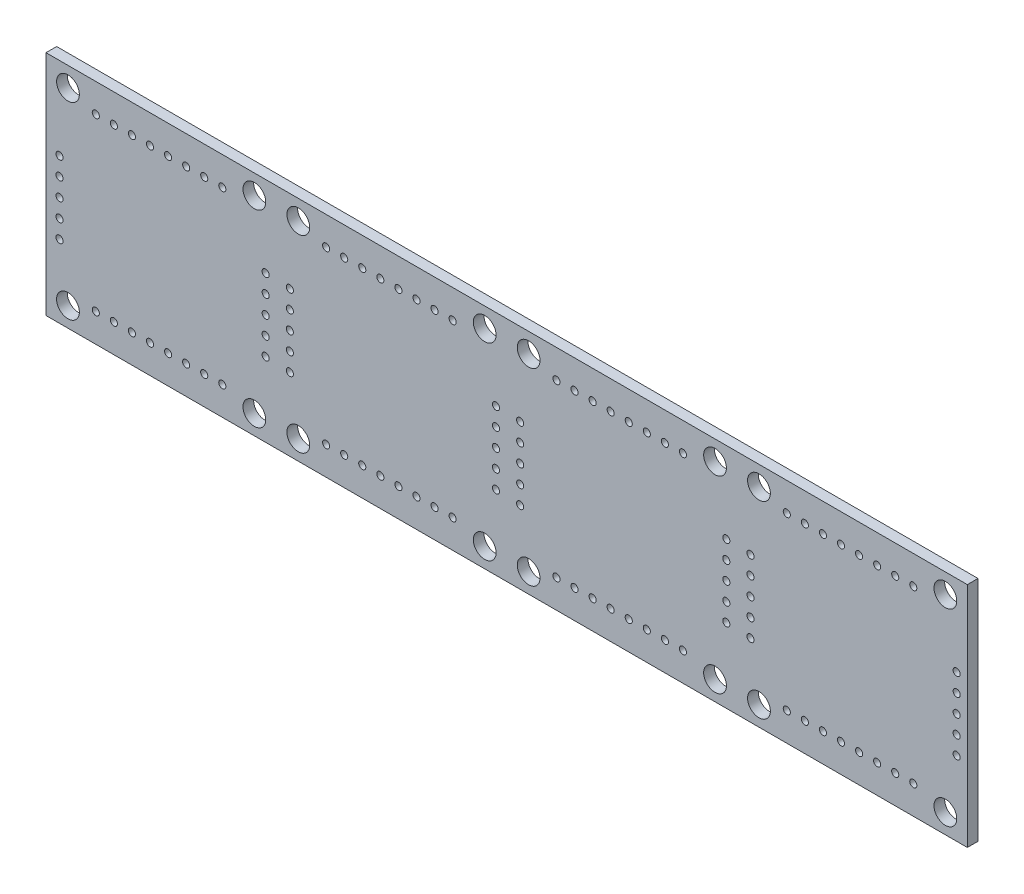
from build123d import *

# Parameters (mm, degrees)
SKETCH1_W                        = 32.375
SKETCH1_H                        = 32
SKETCH1_R                        = 1.6
BOSS_EXTRUDE1_DEPTH              = 1.5
SKETCH3_R                        = 0.5
CUT_EXTRUDE1_DEPTH               = 1.5
R_P_TITION_LIN_AIRE1_OUTLINE_W   = 97.125
R_P_TITION_LIN_AIRE1_OUTLINE_H   = 32
R_P_TITION_LIN_AIRE1_OUTLINE_R   = 1.6
R_P_TITION_LIN_AIRE1_OUTLINE_R_2 = 0.5
R_P_TITION_LIN_AIRE1_DEPTH       = 1.5


# Read off the part's stored shape, not the designer's step: Répétition linéaire1
with BuildPart() as part:
    # Sketch1 → Boss-Extrude1 (new body)
    with BuildSketch(Plane.XY):
        Rectangle(SKETCH1_W, SKETCH1_H)
        with Locations((-13.1, -13.25)):
            Circle(SKETCH1_R, mode=Mode.SUBTRACT)
        with Locations((13.1, -13.25)):
            Circle(SKETCH1_R, mode=Mode.SUBTRACT)
        with Locations((13.1, 13.25)):
            Circle(SKETCH1_R, mode=Mode.SUBTRACT)
        with Locations((-13.1, 13.25)):
            Circle(SKETCH1_R, mode=Mode.SUBTRACT)
    extrude(amount=BOSS_EXTRUDE1_DEPTH)

    # Sketch3 → Cut-Extrude1 (cut)
    with BuildSketch(Plane(origin=(0, 0, 0), x_dir=(-1, 0, 0), z_dir=(0, 0, -1))):
        with Locations((-14.6875, 4.6)):
            Circle(SKETCH3_R)
        with Locations((-14.6875, 2.06)):
            Circle(SKETCH3_R)
        with Locations((-14.6875, -0.48)):
            Circle(SKETCH3_R)
        with Locations((-14.6875, -3.02)):
            Circle(SKETCH3_R)
        with Locations((-14.6875, -5.56)):
            Circle(SKETCH3_R)
        with Locations((9.1875, 12)):
            Circle(SKETCH3_R)
        with Locations((6.6475, 12)):
            Circle(SKETCH3_R)
        with Locations((4.1075, 12)):
            Circle(SKETCH3_R)
        with Locations((1.5675, 12)):
            Circle(SKETCH3_R)
        with Locations((-0.9725, 12)):
            Circle(SKETCH3_R)
        with Locations((-3.5125, 12)):
            Circle(SKETCH3_R)
        with Locations((-6.0525, 12)):
            Circle(SKETCH3_R)
        with Locations((-8.5925, 12)):
            Circle(SKETCH3_R)
        with Locations((9.1875, -12)):
            Circle(SKETCH3_R)
        with Locations((6.6475, -12)):
            Circle(SKETCH3_R)
        with Locations((4.1075, -12)):
            Circle(SKETCH3_R)
        with Locations((1.5675, -12)):
            Circle(SKETCH3_R)
        with Locations((-0.9725, -12)):
            Circle(SKETCH3_R)
        with Locations((-3.5125, -12)):
            Circle(SKETCH3_R)
        with Locations((-6.0525, -12)):
            Circle(SKETCH3_R)
        with Locations((-8.5925, -12)):
            Circle(SKETCH3_R)
        with Locations((14.2875, 4.4)):
            Circle(SKETCH3_R)
        with Locations((14.2875, 1.86)):
            Circle(SKETCH3_R)
        with Locations((14.2875, -0.68)):
            Circle(SKETCH3_R)
        with Locations((14.2875, -3.22)):
            Circle(SKETCH3_R)
        with Locations((14.2875, -5.76)):
            Circle(SKETCH3_R)
    extrude(amount=-CUT_EXTRUDE1_DEPTH, mode=Mode.SUBTRACT)

    # Répétition linéaire1 outline → Répétition linéaire1 (add)
    with BuildSketch(Plane.XY):
        with Locations((64.75, 0)):
            Rectangle(R_P_TITION_LIN_AIRE1_OUTLINE_W, R_P_TITION_LIN_AIRE1_OUTLINE_H)
        with Locations((19.275, -13.25)):
            Circle(R_P_TITION_LIN_AIRE1_OUTLINE_R, mode=Mode.SUBTRACT)
        with Locations((23.1875, -12)):
            Circle(R_P_TITION_LIN_AIRE1_OUTLINE_R_2, mode=Mode.SUBTRACT)
        with Locations((25.7275, -12)):
            Circle(R_P_TITION_LIN_AIRE1_OUTLINE_R_2, mode=Mode.SUBTRACT)
        with Locations((28.2675, -12)):
            Circle(R_P_TITION_LIN_AIRE1_OUTLINE_R_2, mode=Mode.SUBTRACT)
        with Locations((30.8075, -12)):
            Circle(R_P_TITION_LIN_AIRE1_OUTLINE_R_2, mode=Mode.SUBTRACT)
        with Locations((33.3475, -12)):
            Circle(R_P_TITION_LIN_AIRE1_OUTLINE_R_2, mode=Mode.SUBTRACT)
        with Locations((35.8875, -12)):
            Circle(R_P_TITION_LIN_AIRE1_OUTLINE_R_2, mode=Mode.SUBTRACT)
        with Locations((38.4275, -12)):
            Circle(R_P_TITION_LIN_AIRE1_OUTLINE_R_2, mode=Mode.SUBTRACT)
        with Locations((45.475, -13.25)):
            Circle(R_P_TITION_LIN_AIRE1_OUTLINE_R, mode=Mode.SUBTRACT)
        with Locations((51.65, -13.25)):
            Circle(R_P_TITION_LIN_AIRE1_OUTLINE_R, mode=Mode.SUBTRACT)
        with Locations((40.9675, -12)):
            Circle(R_P_TITION_LIN_AIRE1_OUTLINE_R_2, mode=Mode.SUBTRACT)
        with Locations((55.5625, -12)):
            Circle(R_P_TITION_LIN_AIRE1_OUTLINE_R_2, mode=Mode.SUBTRACT)
        with Locations((58.1025, -12)):
            Circle(R_P_TITION_LIN_AIRE1_OUTLINE_R_2, mode=Mode.SUBTRACT)
        with Locations((60.6425, -12)):
            Circle(R_P_TITION_LIN_AIRE1_OUTLINE_R_2, mode=Mode.SUBTRACT)
        with Locations((63.1825, -12)):
            Circle(R_P_TITION_LIN_AIRE1_OUTLINE_R_2, mode=Mode.SUBTRACT)
        with Locations((18.0875, -5.76)):
            Circle(R_P_TITION_LIN_AIRE1_OUTLINE_R_2, mode=Mode.SUBTRACT)
        with Locations((18.0875, -3.22)):
            Circle(R_P_TITION_LIN_AIRE1_OUTLINE_R_2, mode=Mode.SUBTRACT)
        with Locations((18.0875, -0.68)):
            Circle(R_P_TITION_LIN_AIRE1_OUTLINE_R_2, mode=Mode.SUBTRACT)
        with Locations((47.0625, -5.56)):
            Circle(R_P_TITION_LIN_AIRE1_OUTLINE_R_2, mode=Mode.SUBTRACT)
        with Locations((50.4625, -5.76)):
            Circle(R_P_TITION_LIN_AIRE1_OUTLINE_R_2, mode=Mode.SUBTRACT)
        with Locations((47.0625, -3.02)):
            Circle(R_P_TITION_LIN_AIRE1_OUTLINE_R_2, mode=Mode.SUBTRACT)
        with Locations((50.4625, -3.22)):
            Circle(R_P_TITION_LIN_AIRE1_OUTLINE_R_2, mode=Mode.SUBTRACT)
        with Locations((47.0625, -0.48)):
            Circle(R_P_TITION_LIN_AIRE1_OUTLINE_R_2, mode=Mode.SUBTRACT)
        with Locations((50.4625, -0.68)):
            Circle(R_P_TITION_LIN_AIRE1_OUTLINE_R_2, mode=Mode.SUBTRACT)
        with Locations((77.85, -13.25)):
            Circle(R_P_TITION_LIN_AIRE1_OUTLINE_R, mode=Mode.SUBTRACT)
        with Locations((84.025, -13.25)):
            Circle(R_P_TITION_LIN_AIRE1_OUTLINE_R, mode=Mode.SUBTRACT)
        with Locations((65.7225, -12)):
            Circle(R_P_TITION_LIN_AIRE1_OUTLINE_R_2, mode=Mode.SUBTRACT)
        with Locations((68.2625, -12)):
            Circle(R_P_TITION_LIN_AIRE1_OUTLINE_R_2, mode=Mode.SUBTRACT)
        with Locations((70.8025, -12)):
            Circle(R_P_TITION_LIN_AIRE1_OUTLINE_R_2, mode=Mode.SUBTRACT)
        with Locations((73.3425, -12)):
            Circle(R_P_TITION_LIN_AIRE1_OUTLINE_R_2, mode=Mode.SUBTRACT)
        with Locations((87.9375, -12)):
            Circle(R_P_TITION_LIN_AIRE1_OUTLINE_R_2, mode=Mode.SUBTRACT)
        with Locations((110.225, -13.25)):
            Circle(R_P_TITION_LIN_AIRE1_OUTLINE_R, mode=Mode.SUBTRACT)
        with Locations((90.4775, -12)):
            Circle(R_P_TITION_LIN_AIRE1_OUTLINE_R_2, mode=Mode.SUBTRACT)
        with Locations((93.0175, -12)):
            Circle(R_P_TITION_LIN_AIRE1_OUTLINE_R_2, mode=Mode.SUBTRACT)
        with Locations((95.5575, -12)):
            Circle(R_P_TITION_LIN_AIRE1_OUTLINE_R_2, mode=Mode.SUBTRACT)
        with Locations((98.0975, -12)):
            Circle(R_P_TITION_LIN_AIRE1_OUTLINE_R_2, mode=Mode.SUBTRACT)
        with Locations((100.6375, -12)):
            Circle(R_P_TITION_LIN_AIRE1_OUTLINE_R_2, mode=Mode.SUBTRACT)
        with Locations((103.1775, -12)):
            Circle(R_P_TITION_LIN_AIRE1_OUTLINE_R_2, mode=Mode.SUBTRACT)
        with Locations((105.7175, -12)):
            Circle(R_P_TITION_LIN_AIRE1_OUTLINE_R_2, mode=Mode.SUBTRACT)
        with Locations((79.4375, -5.56)):
            Circle(R_P_TITION_LIN_AIRE1_OUTLINE_R_2, mode=Mode.SUBTRACT)
        with Locations((82.8375, -5.76)):
            Circle(R_P_TITION_LIN_AIRE1_OUTLINE_R_2, mode=Mode.SUBTRACT)
        with Locations((79.4375, -3.02)):
            Circle(R_P_TITION_LIN_AIRE1_OUTLINE_R_2, mode=Mode.SUBTRACT)
        with Locations((82.8375, -3.22)):
            Circle(R_P_TITION_LIN_AIRE1_OUTLINE_R_2, mode=Mode.SUBTRACT)
        with Locations((79.4375, -0.48)):
            Circle(R_P_TITION_LIN_AIRE1_OUTLINE_R_2, mode=Mode.SUBTRACT)
        with Locations((82.8375, -0.68)):
            Circle(R_P_TITION_LIN_AIRE1_OUTLINE_R_2, mode=Mode.SUBTRACT)
        with Locations((111.8125, -5.56)):
            Circle(R_P_TITION_LIN_AIRE1_OUTLINE_R_2, mode=Mode.SUBTRACT)
        with Locations((111.8125, -3.02)):
            Circle(R_P_TITION_LIN_AIRE1_OUTLINE_R_2, mode=Mode.SUBTRACT)
        with Locations((111.8125, -0.48)):
            Circle(R_P_TITION_LIN_AIRE1_OUTLINE_R_2, mode=Mode.SUBTRACT)
        with Locations((18.0875, 1.86)):
            Circle(R_P_TITION_LIN_AIRE1_OUTLINE_R_2, mode=Mode.SUBTRACT)
        with Locations((18.0875, 4.4)):
            Circle(R_P_TITION_LIN_AIRE1_OUTLINE_R_2, mode=Mode.SUBTRACT)
        with Locations((50.4625, 1.86)):
            Circle(R_P_TITION_LIN_AIRE1_OUTLINE_R_2, mode=Mode.SUBTRACT)
        with Locations((47.0625, 2.06)):
            Circle(R_P_TITION_LIN_AIRE1_OUTLINE_R_2, mode=Mode.SUBTRACT)
        with Locations((47.0625, 4.6)):
            Circle(R_P_TITION_LIN_AIRE1_OUTLINE_R_2, mode=Mode.SUBTRACT)
        with Locations((50.4625, 4.4)):
            Circle(R_P_TITION_LIN_AIRE1_OUTLINE_R_2, mode=Mode.SUBTRACT)
        with Locations((19.275, 13.25)):
            Circle(R_P_TITION_LIN_AIRE1_OUTLINE_R, mode=Mode.SUBTRACT)
        with Locations((23.1875, 12)):
            Circle(R_P_TITION_LIN_AIRE1_OUTLINE_R_2, mode=Mode.SUBTRACT)
        with Locations((25.7275, 12)):
            Circle(R_P_TITION_LIN_AIRE1_OUTLINE_R_2, mode=Mode.SUBTRACT)
        with Locations((28.2675, 12)):
            Circle(R_P_TITION_LIN_AIRE1_OUTLINE_R_2, mode=Mode.SUBTRACT)
        with Locations((30.8075, 12)):
            Circle(R_P_TITION_LIN_AIRE1_OUTLINE_R_2, mode=Mode.SUBTRACT)
        with Locations((33.3475, 12)):
            Circle(R_P_TITION_LIN_AIRE1_OUTLINE_R_2, mode=Mode.SUBTRACT)
        with Locations((35.8875, 12)):
            Circle(R_P_TITION_LIN_AIRE1_OUTLINE_R_2, mode=Mode.SUBTRACT)
        with Locations((38.4275, 12)):
            Circle(R_P_TITION_LIN_AIRE1_OUTLINE_R_2, mode=Mode.SUBTRACT)
        with Locations((40.9675, 12)):
            Circle(R_P_TITION_LIN_AIRE1_OUTLINE_R_2, mode=Mode.SUBTRACT)
        with Locations((45.475, 13.25)):
            Circle(R_P_TITION_LIN_AIRE1_OUTLINE_R, mode=Mode.SUBTRACT)
        with Locations((51.65, 13.25)):
            Circle(R_P_TITION_LIN_AIRE1_OUTLINE_R, mode=Mode.SUBTRACT)
        with Locations((55.5625, 12)):
            Circle(R_P_TITION_LIN_AIRE1_OUTLINE_R_2, mode=Mode.SUBTRACT)
        with Locations((58.1025, 12)):
            Circle(R_P_TITION_LIN_AIRE1_OUTLINE_R_2, mode=Mode.SUBTRACT)
        with Locations((60.6425, 12)):
            Circle(R_P_TITION_LIN_AIRE1_OUTLINE_R_2, mode=Mode.SUBTRACT)
        with Locations((63.1825, 12)):
            Circle(R_P_TITION_LIN_AIRE1_OUTLINE_R_2, mode=Mode.SUBTRACT)
        with Locations((82.8375, 1.86)):
            Circle(R_P_TITION_LIN_AIRE1_OUTLINE_R_2, mode=Mode.SUBTRACT)
        with Locations((79.4375, 2.06)):
            Circle(R_P_TITION_LIN_AIRE1_OUTLINE_R_2, mode=Mode.SUBTRACT)
        with Locations((79.4375, 4.6)):
            Circle(R_P_TITION_LIN_AIRE1_OUTLINE_R_2, mode=Mode.SUBTRACT)
        with Locations((82.8375, 4.4)):
            Circle(R_P_TITION_LIN_AIRE1_OUTLINE_R_2, mode=Mode.SUBTRACT)
        with Locations((111.8125, 2.06)):
            Circle(R_P_TITION_LIN_AIRE1_OUTLINE_R_2, mode=Mode.SUBTRACT)
        with Locations((111.8125, 4.6)):
            Circle(R_P_TITION_LIN_AIRE1_OUTLINE_R_2, mode=Mode.SUBTRACT)
        with Locations((65.7225, 12)):
            Circle(R_P_TITION_LIN_AIRE1_OUTLINE_R_2, mode=Mode.SUBTRACT)
        with Locations((68.2625, 12)):
            Circle(R_P_TITION_LIN_AIRE1_OUTLINE_R_2, mode=Mode.SUBTRACT)
        with Locations((70.8025, 12)):
            Circle(R_P_TITION_LIN_AIRE1_OUTLINE_R_2, mode=Mode.SUBTRACT)
        with Locations((73.3425, 12)):
            Circle(R_P_TITION_LIN_AIRE1_OUTLINE_R_2, mode=Mode.SUBTRACT)
        with Locations((77.85, 13.25)):
            Circle(R_P_TITION_LIN_AIRE1_OUTLINE_R, mode=Mode.SUBTRACT)
        with Locations((87.9375, 12)):
            Circle(R_P_TITION_LIN_AIRE1_OUTLINE_R_2, mode=Mode.SUBTRACT)
        with Locations((84.025, 13.25)):
            Circle(R_P_TITION_LIN_AIRE1_OUTLINE_R, mode=Mode.SUBTRACT)
        with Locations((90.4775, 12)):
            Circle(R_P_TITION_LIN_AIRE1_OUTLINE_R_2, mode=Mode.SUBTRACT)
        with Locations((93.0175, 12)):
            Circle(R_P_TITION_LIN_AIRE1_OUTLINE_R_2, mode=Mode.SUBTRACT)
        with Locations((95.5575, 12)):
            Circle(R_P_TITION_LIN_AIRE1_OUTLINE_R_2, mode=Mode.SUBTRACT)
        with Locations((98.0975, 12)):
            Circle(R_P_TITION_LIN_AIRE1_OUTLINE_R_2, mode=Mode.SUBTRACT)
        with Locations((100.6375, 12)):
            Circle(R_P_TITION_LIN_AIRE1_OUTLINE_R_2, mode=Mode.SUBTRACT)
        with Locations((103.1775, 12)):
            Circle(R_P_TITION_LIN_AIRE1_OUTLINE_R_2, mode=Mode.SUBTRACT)
        with Locations((105.7175, 12)):
            Circle(R_P_TITION_LIN_AIRE1_OUTLINE_R_2, mode=Mode.SUBTRACT)
        with Locations((110.225, 13.25)):
            Circle(R_P_TITION_LIN_AIRE1_OUTLINE_R, mode=Mode.SUBTRACT)
    extrude(amount=R_P_TITION_LIN_AIRE1_DEPTH)


solid = part.part
